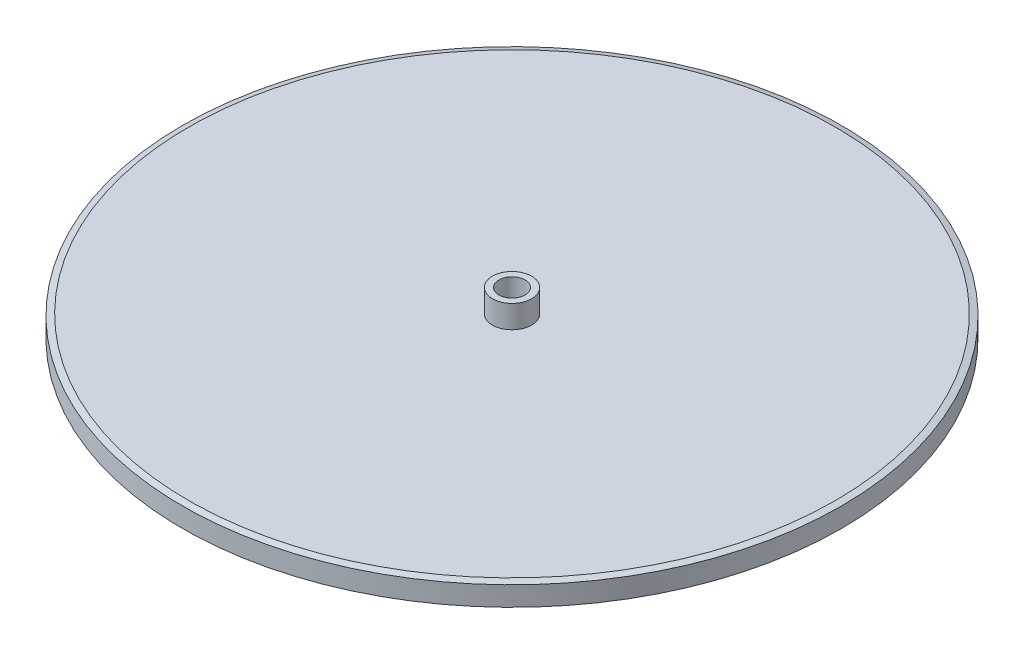
from build123d import *

# Parameters (mm, degrees)
CHAMFER_1_SIZE           = 0.94
CHAMFER_1_SIZE2          = 0.251872241
CHAMFER_2_SIZE           = 0.94
CHAMFER_2_SIZE2          = 0.251872241
CUT_EXTRUDE_3_DEPTH      = 72.760016722
CUT_EXTRUDE_3_DEPTH_BACK = 72.760016722
SKETCH_2_R               = 2


with BuildPart() as part:
    # Эскиз1 → Повернуть2 (revolve)
    with BuildSketch(Plane.XY):
        Polygon((0, 0), (50.5, 0), (50.5, 3.5), (3, 3.5), (3, 7), (0, 7), align=None)
    revolve(axis=Axis((0, 7, 0), (0, -1, 0)))

    # Фаска1
    chamfer_1_edges = [part.edges().sort_by_distance(p)[0] for p in [
        (-50.5, 3.5, 0),
    ]]
    chamfer_1_side = [part.faces().sort_by_distance(p)[0] for p in [
        (-49.071644302, 3.5, 0),
    ]]
    chamfer(chamfer_1_edges, length=CHAMFER_1_SIZE, length2=CHAMFER_1_SIZE2, reference=chamfer_1_side[0])

    # Фаска2
    chamfer_2_edges = [part.edges().sort_by_distance(p)[0] for p in [
        (-50.5, 0, 0),
    ]]
    chamfer_2_side = [part.faces().sort_by_distance(p)[0] for p in [
        (0, 0, 0),
    ]]
    chamfer(chamfer_2_edges, length=CHAMFER_2_SIZE, length2=CHAMFER_2_SIZE2, reference=chamfer_2_side[0])

    # Эскиз2 → Вырез-Вытянуть3 (cut, two sides: drawn at the far end of the back side and taken through both)
    with BuildSketch(Plane(origin=(0, 0, 0), x_dir=(-1, 0, 0), z_dir=(0, -1, 0)).offset(-CUT_EXTRUDE_3_DEPTH_BACK)):
        Circle(SKETCH_2_R)
    extrude(amount=CUT_EXTRUDE_3_DEPTH + CUT_EXTRUDE_3_DEPTH_BACK, mode=Mode.SUBTRACT)


solid = part.part
